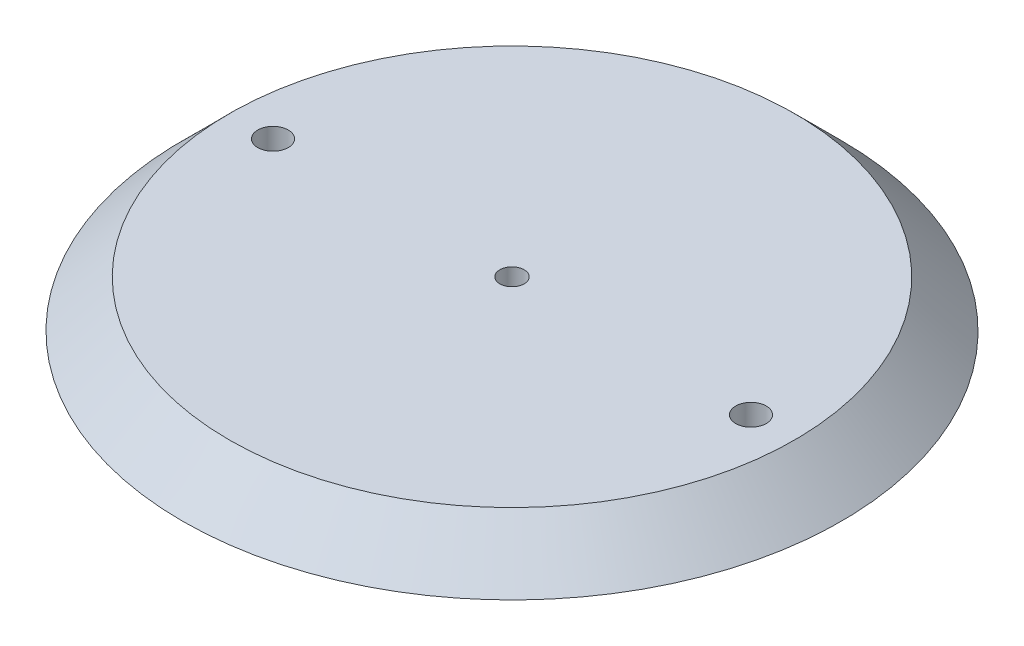
from build123d import *

# Parameters (mm, degrees)
SKETCH1_R                      = 85.725
BOSS_EXTRUDE1_DEPTH            = 12.192
BOSS_EXTRUDE1_TAPER            = 45
F_3_8_16_TAPPED_HOLE1_D        = 7.9375
F_1_4_0_25_PRESS_DOWEL_HOLE1_D = 6.35


with BuildPart() as part:
    # Sketch1 → Boss-Extrude1 (new body)
    with BuildSketch(Plane(origin=(0, 0, 0), x_dir=(1, 0, 0), z_dir=(0, 1, 0))):
        Circle(SKETCH1_R)
    extrude(amount=BOSS_EXTRUDE1_DEPTH, taper=BOSS_EXTRUDE1_TAPER)

    # 3/8-16 Tapped Hole1 (through all)
    with Locations(Plane(origin=(0, 12.192, 0), x_dir=(-0.9997060077974085, 0, -0.024246607469250836), z_dir=(0, 1, 0))):
        with Locations((-62.148223534, -1.507326723), (62.148223534, 1.507326723)):
            Hole(F_3_8_16_TAPPED_HOLE1_D / 2)

    # 1/4 (0.25) Press Dowel Hole1 (through all)
    with Locations(Plane(origin=(-177.991498203, 12.192, 193.466008664), x_dir=(-0.909586317376337, 0, -0.4155150192733753), z_dir=(0, 1, 0))):
        with Locations((-81.510599056, -249.932175164)):
            Hole(F_1_4_0_25_PRESS_DOWEL_HOLE1_D / 2)


solid = part.part
